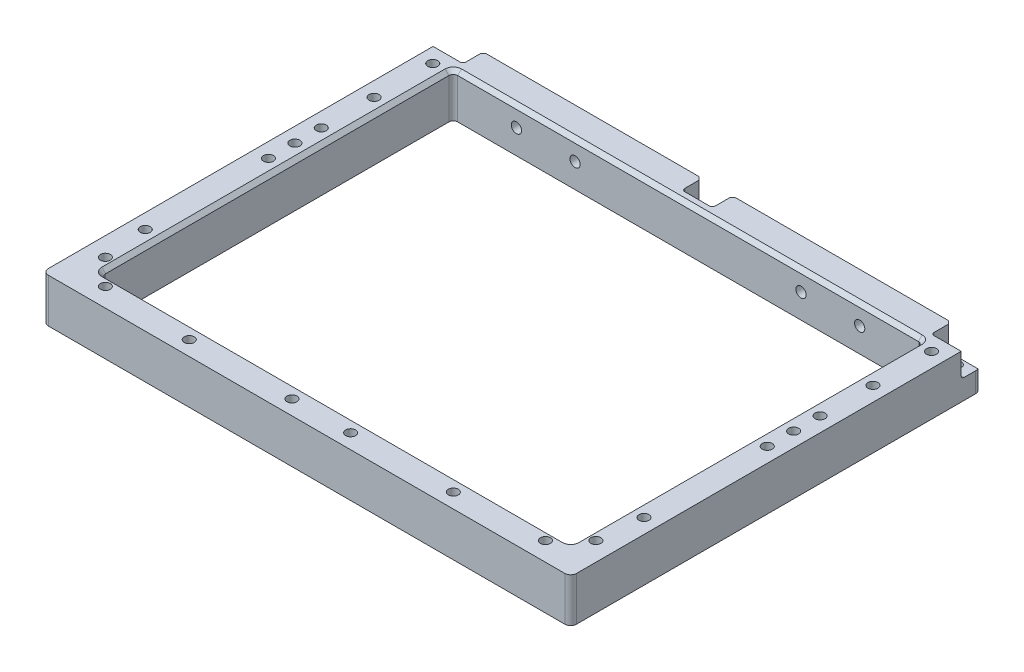
from build123d import *

# Parameters (mm, degrees)
SKETCH1_W                  = 228.6
SKETCH1_H                  = 177.8
SKETCH1_W_2                = 203.2
SKETCH1_H_2                = 152.4
BOSS_EXTRUDE1_DEPTH        = 19.05
SKETCH2_W                  = 12.954
SKETCH2_H                  = 10.414
SKETCH2_W_2                = 13.208
CUT_EXTRUDE1_DEPTH         = 8.763
SKETCH3_R                  = 2.159
CUT_EXTRUDE2_DEPTH         = 6.35
FILLET2_R                  = 1.27
CHAMFER1_SIZE              = 1.27
SKETCH4_R                  = 1.905
CUT_EXTRUDE3_DEPTH         = 7.112
SKETCH5_R                  = 2.159
CUT_EXTRUDE4_DEPTH         = 7.112
FILLET3_R                  = 1.905
SKETCH6_R                  = 2.159
MOTOR_MOUNT_HOLES_DEPTH    = 7.112
CHAMFER2_SIZE              = 1.651
SKETCH7_R                  = 2.159
REARBRACE_MOUNTHOLES_DEPTH = 7.112
SKETCH8_R                  = 2.159
SIDEBRACE_MOUNTHOLES_DEPTH = 7.112
SKETCH9_R                  = 2.159
BATTERYMOUNT_HOLES_DEPTH   = 7.112
FILLET4_R                  = 2.54
SKETCH10_R                 = 2.2225
CUT_EXTRUDE5_DEPTH         = 5.08


with BuildPart() as part:
    # Sketch1 → Boss-Extrude1 (new body)
    with BuildSketch(Plane(origin=(0, 0, 0), x_dir=(1, 0, 0), z_dir=(0, 1, 0))):
        Rectangle(SKETCH1_W, SKETCH1_H)
        Rectangle(SKETCH1_W_2, SKETCH1_H_2, mode=Mode.SUBTRACT)
    extrude(amount=BOSS_EXTRUDE1_DEPTH)

    # Sketch2 → Cut-Extrude1 (cut)
    with BuildSketch(Plane(origin=(0, 0, -88.9), x_dir=(-1, 0, 0), z_dir=(0, 0, -1))):
        with Locations((107.823, 13.843)):
            Rectangle(SKETCH2_W, SKETCH2_H)
        with Locations((0, 13.843)):
            Rectangle(SKETCH2_W_2, SKETCH2_H)
        with Locations((-107.823, 13.843)):
            Rectangle(SKETCH2_W, SKETCH2_H)
    extrude(amount=-CUT_EXTRUDE1_DEPTH, mode=Mode.SUBTRACT)

    # Sketch3 → Cut-Extrude2 (cut)
    with BuildSketch(Plane(origin=(0, 8.636, 0), x_dir=(1, 0, 0), z_dir=(0, 1, 0))):
        with Locations((-107.823, 84.5185)):
            Circle(SKETCH3_R)
        with Locations((0, 84.5185)):
            Circle(SKETCH3_R)
        with Locations((107.823, 84.5185)):
            Circle(SKETCH3_R)
    extrude(amount=-CUT_EXTRUDE2_DEPTH, mode=Mode.SUBTRACT)

    # Fillet2
    fillet2_edges = [part.edges().sort_by_distance(p)[0] for p in [
        (101.346, 8.636, -84.5185),
        (107.823, 8.636, -80.137),
        (-6.604, 8.636, -84.5185),
        (0, 8.636, -80.137),
        (6.604, 8.636, -84.5185),
        (-107.823, 8.636, -80.137),
        (-101.346, 8.636, -84.5185),
        (-101.346, 13.843, -80.137),
        (-6.604, 13.843, -80.137),
        (6.604, 13.843, -80.137),
        (101.346, 13.843, -80.137),
    ]]
    fillet(fillet2_edges, radius=FILLET2_R)

    # Chamfer1
    chamfer1_edges = [part.edges().sort_by_distance(p)[0] for p in [
        (-108.458, 8.636, -88.9),
        (-101.717974388, 9.007974388, -88.9),
        (-101.346, 14.478, -88.9),
        (-6.604, 14.478, -88.9),
        (-6.232025612, 9.007974388, -88.9),
        (0, 8.636, -88.9),
        (6.232025612, 9.007974388, -88.9),
        (6.604, 14.478, -88.9),
        (108.458, 8.636, -88.9),
        (101.717974388, 9.007974388, -88.9),
        (101.346, 14.478, -88.9),
    ]]
    chamfer(chamfer1_edges, length=CHAMFER1_SIZE)

    # Sketch4 → Cut-Extrude3 (cut)
    with BuildSketch(Plane(origin=(0, 0, -88.9), x_dir=(-1, 0, 0), z_dir=(0, 0, -1))):
        with Locations((-20.32, 9.525)):
            Circle(SKETCH4_R)
        with Locations((-81.28, 9.525)):
            Circle(SKETCH4_R)
        with Locations((81.28, 9.525)):
            Circle(SKETCH4_R)
        with Locations((20.32, 9.525)):
            Circle(SKETCH4_R)
    extrude(amount=-CUT_EXTRUDE3_DEPTH, mode=Mode.SUBTRACT)

    # Sketch5 → Cut-Extrude4 (cut)
    with BuildSketch(Plane(origin=(0, 19.05, 0), x_dir=(1, 0, 0), z_dir=(0, 1, 0))):
        with Locations((-95.25, -80.772)):
            Circle(SKETCH5_R)
        with Locations((-106.172, -69.85)):
            Circle(SKETCH5_R)
        with Locations((106.172, -69.85)):
            Circle(SKETCH5_R)
        with Locations((95.25, -80.772)):
            Circle(SKETCH5_R)
    extrude(amount=-CUT_EXTRUDE4_DEPTH, mode=Mode.SUBTRACT)

    # Fillet3
    fillet3_edges = [part.edges().sort_by_distance(p)[0] for p in [
        (-101.6, 9.525, 76.2),
        (101.6, 9.525, 76.2),
        (101.6, 9.525, -76.2),
        (-101.6, 9.525, -76.2),
    ]]
    fillet(fillet3_edges, radius=FILLET3_R)

    # Sketch6 → Motor_Mount_Holes (cut)
    with BuildSketch(Plane(origin=(0, 19.05, 0), x_dir=(1, 0, 0), z_dir=(0, 1, 0))):
        with Locations((107.95, -50.8)):
            Circle(SKETCH6_R)
        with Locations((107.95, 2.54)):
            Circle(SKETCH6_R)
        with Locations((107.95, 13.97)):
            Circle(SKETCH6_R)
        with Locations((107.95, 25.4)):
            Circle(SKETCH6_R)
        with Locations((-107.95, 25.4)):
            Circle(SKETCH6_R)
        with Locations((-107.95, 13.97)):
            Circle(SKETCH6_R)
        with Locations((-107.95, 2.54)):
            Circle(SKETCH6_R)
        with Locations((-107.95, -50.8)):
            Circle(SKETCH6_R)
    extrude(amount=-MOTOR_MOUNT_HOLES_DEPTH, mode=Mode.SUBTRACT)

    # Chamfer2
    chamfer2_edges = [part.edges().sort_by_distance(p)[0] for p in [
        (-101.6, 19.05, 0),
        (-101.042038418, 19.05, 75.642038418),
        (-101.042038418, 19.05, -75.642038418),
        (0, 19.05, 76.2),
        (0, 19.05, -76.2),
        (101.042038418, 19.05, 75.642038418),
        (101.042038418, 19.05, -75.642038418),
        (101.6, 19.05, 0),
    ]]
    chamfer(chamfer2_edges, length=CHAMFER2_SIZE)

    # Sketch7 → RearBrace_MountHoles (cut)
    with BuildSketch(Plane(origin=(0, 19.05, 0), x_dir=(1, 0, 0), z_dir=(0, 1, 0))):
        with Locations((-12.7, -82.55)):
            Circle(SKETCH7_R)
        with Locations((12.7, -82.55)):
            Circle(SKETCH7_R)
    extrude(amount=-REARBRACE_MOUNTHOLES_DEPTH, mode=Mode.SUBTRACT)

    # Sketch8 → SideBrace_MountHoles (cut)
    with BuildSketch(Plane(origin=(0, 19.05, 0), x_dir=(1, 0, 0), z_dir=(0, 1, 0))):
        with Locations((107.95, 73.66)):
            Circle(SKETCH8_R)
        with Locations((107.95, 48.26)):
            Circle(SKETCH8_R)
        with Locations((-107.95, 48.26)):
            Circle(SKETCH8_R)
        with Locations((-107.95, 73.66)):
            Circle(SKETCH8_R)
    extrude(amount=-SIDEBRACE_MOUNTHOLES_DEPTH, mode=Mode.SUBTRACT)

    # Sketch9 → BatteryMount_Holes (cut)
    with BuildSketch(Plane(origin=(0, 19.05, 0), x_dir=(1, 0, 0), z_dir=(0, 1, 0))):
        with Locations((-57.15, -82.55)):
            Circle(SKETCH9_R)
        with Locations((57.15, -82.55)):
            Circle(SKETCH9_R)
    extrude(amount=-BATTERYMOUNT_HOLES_DEPTH, mode=Mode.SUBTRACT)

    # Fillet4
    fillet4_edges = [part.edges().sort_by_distance(p)[0] for p in [
        (-114.3, 3.683, -88.9),
        (114.3, 3.683, -88.9),
        (-114.3, 9.525, 88.9),
        (114.3, 9.525, 88.9),
    ]]
    fillet(fillet4_edges, radius=FILLET4_R)

    # Sketch10 → Cut-Extrude5 (cut)
    with BuildSketch(Plane.XY.offset(-76.2)):
        with Locations((48.895, 10.541)):
            Circle(SKETCH10_R)
        with Locations((74.295, 10.541)):
            Circle(SKETCH10_R)
        with Locations((-74.295, 10.541)):
            Circle(SKETCH10_R)
        with Locations((-48.895, 10.541)):
            Circle(SKETCH10_R)
    extrude(amount=-CUT_EXTRUDE5_DEPTH, mode=Mode.SUBTRACT)


solid = part.part
